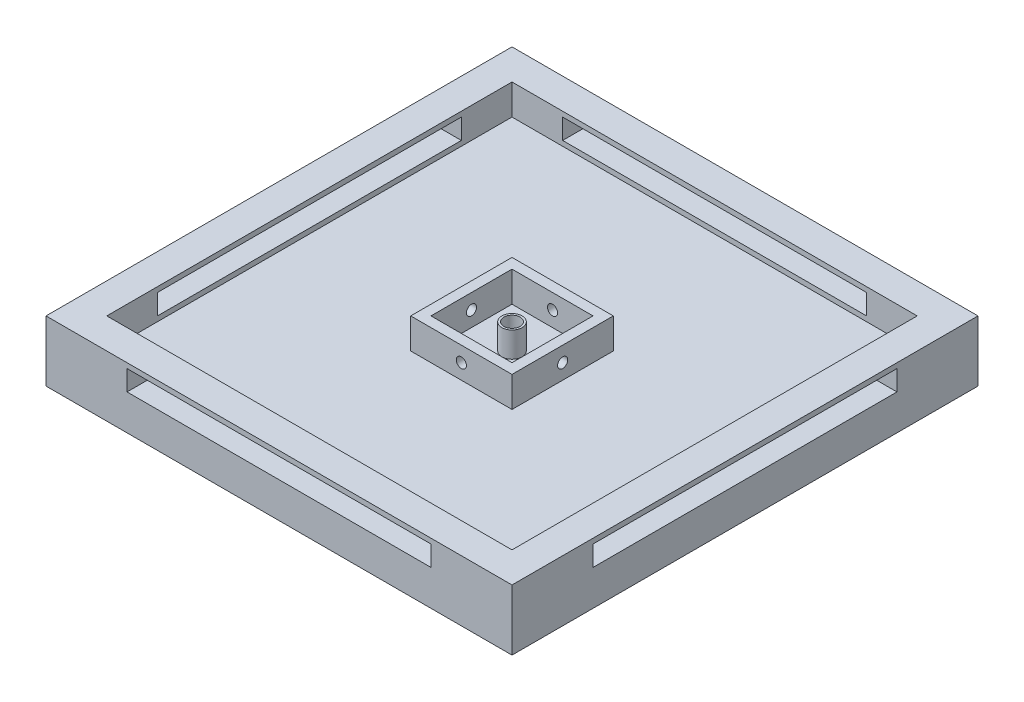
from build123d import *

# Parameters (mm, degrees)
SKETCH1_W                = 40
SKETCH1_H                = 40
BOSS_EXTRUDE1_DEPTH      = 3
SKETCH2_W                = 40
SKETCH2_H                = 6
BOSS_EXTRUDE2_DEPTH      = 3
SKETCH4_W                = 43
SKETCH4_H                = 6
BOSS_EXTRUDE3_DEPTH      = 3
SKETCH5_W                = 43
SKETCH5_H                = 6
BOSS_EXTRUDE4_DEPTH      = 3
SKETCH6_W                = 46
SKETCH6_H                = 6
BOSS_EXTRUDE5_DEPTH      = 3
SKETCH7_W                = 30
SKETCH7_H                = 2
CUT_EXTRUDE1_DEPTH       = 3
MIRROR2_COPY_1_SKETCH_W  = 30
MIRROR2_COPY_1_SKETCH_H  = 2
MIRROR2_COPY_1_DEPTH     = 3
MIRROR2_COPY_2_SKETCH_W  = 30
MIRROR2_COPY_2_SKETCH_H  = 2
MIRROR2_COPY_2_DEPTH     = 3
SKETCH8_W                = 10
SKETCH8_H                = 10
SKETCH8_W_2              = 7.999655552
SKETCH8_H_2              = 7.999655552
BOSS_EXTRUDE6_DEPTH      = 3
SKETCH9_R                = 1
CUT_EXTRUDE2_DEPTH       = 3
SKETCH10_R               = 0.5
CUT_EXTRUDE3_DEPTH       = 10
BOSS_EXTRUDE7_DEPTH      = 2.5
BOSS_EXTRUDE7_DEPTH_BACK = 5
SKETCH11_R               = 1
SKETCH11_R_2             = 0.8


with BuildPart() as part:
    # Sketch1 → Boss-Extrude1 (new body)
    with BuildSketch(Plane(origin=(0, 0, 0), x_dir=(1, 0, 0), z_dir=(0, 1, 0))):
        with Locations((-20, -20)):
            Rectangle(SKETCH1_W, SKETCH1_H)
    extrude(amount=BOSS_EXTRUDE1_DEPTH)



with BuildPart() as body_2:
    # Sketch2 → Boss-Extrude2 (new body)
    with BuildSketch(Plane(origin=(0, 0, 0), x_dir=(0, 0, -1), z_dir=(1, 0, 0))):
        with Locations((-20, 3)):
            Rectangle(SKETCH2_W, SKETCH2_H)
    extrude(amount=BOSS_EXTRUDE2_DEPTH)


with BuildPart() as part_1:
    add(part.part)

    add(body_2.part)  # Boss-Extrude3 merges body 2
    # Sketch4 → Boss-Extrude3 (add)
    with BuildSketch(Plane.XY.offset(40)):
        with Locations((-18.5, 3)):
            Rectangle(SKETCH4_W, SKETCH4_H)
    extrude(amount=BOSS_EXTRUDE3_DEPTH)

    # Sketch5 → Boss-Extrude4 (add)
    with BuildSketch(Plane(origin=(0, 0, 0), x_dir=(-1, 0, 0), z_dir=(0, 0, -1))):
        with Locations((18.5, 3)):
            Rectangle(SKETCH5_W, SKETCH5_H)
    extrude(amount=BOSS_EXTRUDE4_DEPTH)

    # Sketch6 → Boss-Extrude5 (add)
    with BuildSketch(Plane.ZY.offset(40)):
        with Locations((20, 3)):
            Rectangle(SKETCH6_W, SKETCH6_H)
    extrude(amount=BOSS_EXTRUDE5_DEPTH)

    # Sketch7 → Cut-Extrude1 (cut)
    with BuildSketch(Plane.ZY):
        with Locations((20, 4.5)):
            Rectangle(SKETCH7_W, SKETCH7_H)
    cut_extrude1 = extrude(amount=-CUT_EXTRUDE1_DEPTH, mode=Mode.SUBTRACT)

    # Mirror1: Cut-Extrude1 across plane
    add(cut_extrude1.mirror(Plane(origin=(0, 0, 0), x_dir=(-0.7071067811865475, 0, 0.7071067811865477), z_dir=(0.7071067811865476, 0, 0.7071067811865475))), mode=Mode.SUBTRACT)

    # Mirror2 copy 1 sketch → Mirror2 copy 1 (cut)
    with BuildSketch(Plane(origin=(-40, 0, 40), x_dir=(0, 0, -1), z_dir=(1, 0, 0))):
        with Locations((20, 4.5)):
            Rectangle(MIRROR2_COPY_1_SKETCH_W, MIRROR2_COPY_1_SKETCH_H)
    extrude(amount=-MIRROR2_COPY_1_DEPTH, mode=Mode.SUBTRACT)

    # Mirror2 copy 2 sketch → Mirror2 copy 2 (cut)
    with BuildSketch(Plane(origin=(-40, 0, 40), x_dir=(1, 0, 0), z_dir=(0, 0, -1))):
        with Locations((20, -4.5)):
            Rectangle(MIRROR2_COPY_2_SKETCH_W, MIRROR2_COPY_2_SKETCH_H)
    extrude(amount=-MIRROR2_COPY_2_DEPTH, mode=Mode.SUBTRACT)

    # Sketch8 → Boss-Extrude6 (add)
    with BuildSketch(Plane(origin=(0, 3, 0), x_dir=(1, 0, 0), z_dir=(0, 1, 0))):
        with Locations((-20, -20)):
            Rectangle(SKETCH8_W, SKETCH8_H)
        with Locations((-20, -20)):
            Rectangle(SKETCH8_W_2, SKETCH8_H_2, mode=Mode.SUBTRACT)
    extrude(amount=BOSS_EXTRUDE6_DEPTH)

    # Sketch9 → Cut-Extrude2 (cut)
    with BuildSketch(Plane(origin=(0, 3, 0), x_dir=(1, 0, 0), z_dir=(0, 1, 0))):
        with Locations((-20, -20)):
            Circle(SKETCH9_R)
    extrude(amount=-CUT_EXTRUDE2_DEPTH, mode=Mode.SUBTRACT)

    # Sketch10 → Cut-Extrude3 (cut)
    with BuildSketch(Plane.ZY.offset(25)):
        with Locations((20, 4.5)):
            Circle(SKETCH10_R)
    cut_extrude3 = extrude(amount=-CUT_EXTRUDE3_DEPTH, mode=Mode.SUBTRACT)

    # Mirror3: Cut-Extrude3 across plane
    add(cut_extrude3.mirror(Plane(origin=(-20, 0, 20), x_dir=(0.7071067811865476, 0, 0.7071067811865476), z_dir=(0.7071067811865477, 0, -0.7071067811865475))), mode=Mode.SUBTRACT)

    # Sketch11 → Boss-Extrude7 (add, two sides: drawn at the far end of the back side and taken through both)
    with BuildSketch(Plane(origin=(0, 3, 0), x_dir=(1, 0, 0), z_dir=(0, 1, 0)).offset(-BOSS_EXTRUDE7_DEPTH_BACK)):
        with Locations((-20, -20)):
            Circle(SKETCH11_R)
        with Locations((-20, -20)):
            Circle(SKETCH11_R_2, mode=Mode.SUBTRACT)
    extrude(amount=BOSS_EXTRUDE7_DEPTH + BOSS_EXTRUDE7_DEPTH_BACK)


solid = part_1.part
